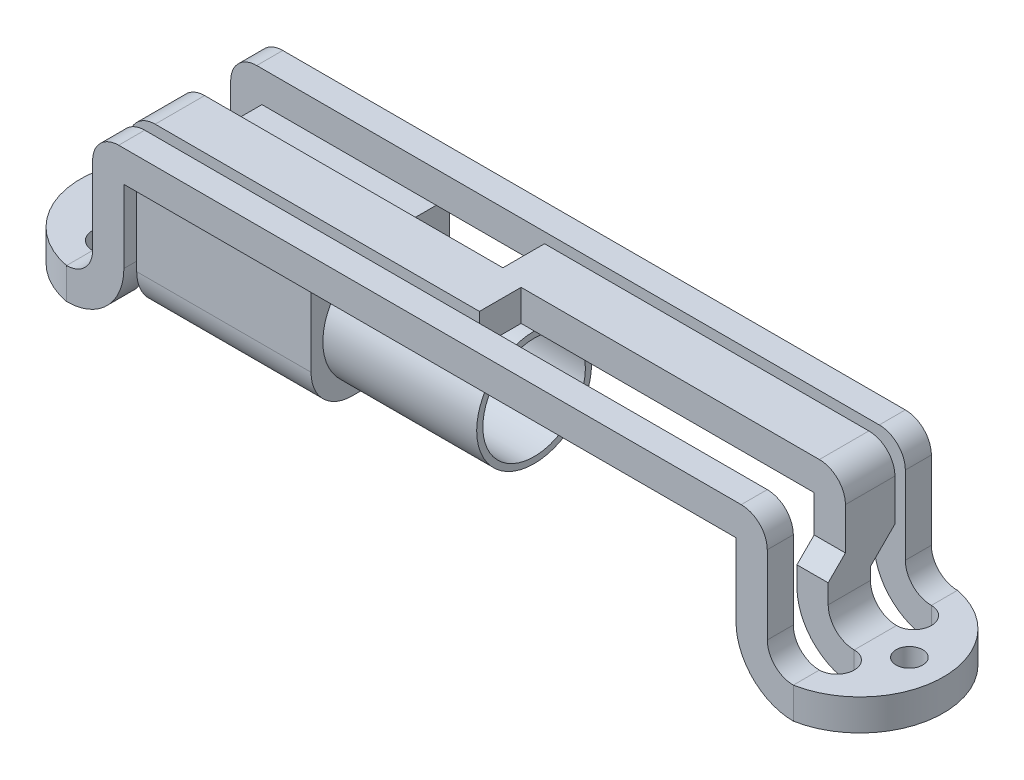
from build123d import *

# Parameters (mm, degrees)
EXTRUDE_THIN1_DEPTH    = 16.002
CUT_EXTRUDE1_START     = -15.748
CUT_EXTRUDE1_OUTLINE_R = 1.3
CUT_EXTRUDE1_DEPTH     = 15.748
BOSS_EXTRUDE2_DEPTH    = 1.68
BOSS_EXTRUDE3_START    = 1.68
BOSS_EXTRUDE3_DEPTH    = 1.68
CUT_EXTRUDE2_START     = -2.384
CUT_EXTRUDE2_DEPTH     = 2.384
CUT_EXTRUDE3_DEPTH     = 2.384
CHAMFER1_SIZE          = 1.7
CHAMFER2_SIZE          = 2.38
SKETCH10_W             = 17
SKETCH10_H             = 13.5
BOSS_EXTRUDE4_DEPTH    = 12
SKETCH11_R             = 5.6
SKETCH11_R_2           = 5
BOSS_EXTRUDE5_DEPTH    = 15
FILLET1_R              = 4


# Read off the part's stored shape, not the designer's step: Cut-Extrude1
with BuildPart() as part:
    # Sketch1 → Extrude-Thin1 (new body)
    with BuildSketch(Plane.XY):
        with BuildLine():
            Line((-42.06875, -12.7), (-35.433, -12.7))
            ThreePointArc((-35.433, -12.7), (-33.636948776, -11.956051224), (-32.893, -10.16))
            Line((-32.893, -10.16), (-32.893, -2.54))
            ThreePointArc((-32.893, -2.54), (-32.149051224, -0.743948776), (-30.353, 0))
            Line((-30.353, 0), (30.353, 0))
            ThreePointArc((30.353, 0), (32.149051224, -0.743948776), (32.893, -2.54))
            Line((32.893, -2.54), (32.893, -10.16))
            ThreePointArc((32.893, -10.16), (33.636948776, -11.956051224), (35.433, -12.7))
            Line((35.433, -12.7), (42.06875, -12.7))
            Line((42.06875, -12.7), (42.06875, -15.748))
            Line((42.06875, -15.748), (35.433, -15.748))
            ThreePointArc((35.433, -15.748), (31.481687307, -14.111312693), (29.845, -10.16))
            Line((29.845, -10.16), (29.845, -3.048))
            Line((29.845, -3.048), (-29.845, -3.048))
            Line((-29.845, -3.048), (-29.845, -10.16))
            ThreePointArc((-29.845, -10.16), (-31.481687307, -14.111312693), (-35.433, -15.748))
            Line((-35.433, -15.748), (-42.06875, -15.748))
            Line((-42.06875, -15.748), (-42.06875, -12.7))
        make_face()
    extrude(amount=-EXTRUDE_THIN1_DEPTH)

    # Cut-Extrude1 outline → Cut-Extrude1 (cut)
    with BuildSketch(Plane(origin=(0, 0, 0), x_dir=(1, 0, 0), z_dir=(0, 1, 0)).offset(CUT_EXTRUDE1_START)):
        with BuildLine():
            Line((35.433, 13.462), (-35.433, 13.462))
            ThreePointArc((-35.433, 13.462), (-37.133, 11.762), (-35.433, 10.062))
            Line((-35.433, 10.062), (-32.893, 10.062))
            Line((-32.893, 10.062), (-32.893, 8.382))
            Line((-32.893, 8.382), (-1.27, 8.382))
            Line((-1.27, 8.382), (-1.27, 12.446))
            Line((-1.27, 12.446), (32.893, 12.446))
            Line((32.893, 12.446), (32.893, 10.062))
            Line((32.893, 10.062), (35.433, 10.062))
            ThreePointArc((35.433, 10.062), (37.133, 11.762), (35.433, 13.462))
        make_face()
        with BuildLine():
            Line((32.893, 5.94), (32.893, 7.62))
            Line((32.893, 7.62), (1.27, 7.62))
            Line((1.27, 7.62), (1.27, 3.556))
            Line((1.27, 3.556), (-32.893, 3.556))
            Line((-32.893, 3.556), (-32.893, 5.94))
            Line((-32.893, 5.94), (-35.433, 5.94))
            ThreePointArc((-35.433, 5.94), (-37.133, 4.24), (-35.433, 2.54))
            Line((-35.433, 2.54), (35.433, 2.54))
            ThreePointArc((35.433, 2.54), (37.133, 4.24), (35.433, 5.94))
            Line((35.433, 5.94), (32.893, 5.94))
        make_face()
        with BuildLine():
            Line((42.06875, 16.002), (35.433, 16.002))
            ThreePointArc((35.433, 16.002), (40.193949205, 13.198335352), (42.06875, 8.001))
            Line((42.06875, 8.001), (42.06875, 16.002))
        make_face()
        with BuildLine():
            Line((42.06875, 0), (42.06875, 8.001))
            ThreePointArc((42.06875, 8.001), (40.193949205, 2.803664648), (35.433, 0))
            Line((35.433, 0), (42.06875, 0))
        make_face()
        with BuildLine():
            ThreePointArc((-42.06875, 8.001), (-40.193949205, 13.198335352), (-35.433, 16.002))
            Line((-35.433, 16.002), (-42.06875, 16.002))
            Line((-42.06875, 16.002), (-42.06875, 8.001))
        make_face()
        with BuildLine():
            ThreePointArc((-35.433, 0), (-40.193949205, 2.803664648), (-42.06875, 8.001))
            Line((-42.06875, 8.001), (-42.06875, 0))
            Line((-42.06875, 0), (-35.433, 0))
        make_face()
        with Locations((38.750875, 8.001)):
            Circle(CUT_EXTRUDE1_OUTLINE_R)
        with Locations((-38.750875, 8.001)):
            Circle(CUT_EXTRUDE1_OUTLINE_R)
    extrude(amount=CUT_EXTRUDE1_DEPTH, mode=Mode.SUBTRACT)

    # Sketch6 → Boss-Extrude2 (add)
    with BuildSketch(Plane(origin=(0, 0, -8.382), x_dir=(-1, 0, 0), z_dir=(0, 0, -1))):
        with BuildLine():
            Line((32.893, -10.16), (32.893, -6.604))
            Line((32.893, -6.604), (29.845, -6.604))
            Line((29.845, -6.604), (29.845, -10.16))
            ThreePointArc((29.845, -10.16), (30.667537588, -13.078237824), (32.893, -15.137363157))
            Line((32.893, -15.137363157), (32.893, -10.16))
        make_face()
    extrude(amount=BOSS_EXTRUDE2_DEPTH)

    # Sketch7 → Boss-Extrude3 (add)
    with BuildSketch(Plane.XY.offset(-7.62).offset(BOSS_EXTRUDE3_START)):
        with BuildLine():
            Line((32.893, -10.16), (32.893, -6.6))
            Line((32.893, -6.6), (29.845, -6.604))
            Line((29.845, -6.604), (29.845, -10.16))
            ThreePointArc((29.845, -10.16), (30.667537588, -13.078237824), (32.893, -15.137363157))
            Line((32.893, -15.137363157), (32.893, -10.16))
        make_face()
    extrude(amount=-BOSS_EXTRUDE3_DEPTH)

    # Sketch8 → Cut-Extrude2 (cut)
    with BuildSketch(Plane(origin=(0, 0, -12.446), x_dir=(-1, 0, 0), z_dir=(0, 0, -1)).offset(CUT_EXTRUDE2_START)):
        with BuildLine():
            Line((-32.893, -15.137363157), (-32.893, -6.6))
            Line((-32.893, -6.6), (-29.845, -6.604))
            Line((-29.845, -6.604), (-29.845, -10.16))
            ThreePointArc((-29.845, -10.16), (-30.667537588, -13.078237824), (-32.893, -15.137363157))
        make_face()
    extrude(amount=CUT_EXTRUDE2_DEPTH, mode=Mode.SUBTRACT)

    # Sketch9 → Cut-Extrude3 (cut)
    with BuildSketch(Plane.XY.offset(-3.556)):
        with BuildLine():
            Line((-32.893, -15.137363157), (-32.893, -6.604))
            Line((-32.893, -6.604), (-29.845, -6.604))
            Line((-29.845, -6.604), (-29.845, -10.16))
            ThreePointArc((-29.845, -10.16), (-30.667537588, -13.078237824), (-32.893, -15.137363157))
        make_face()
    extrude(amount=-CUT_EXTRUDE3_DEPTH, mode=Mode.SUBTRACT)

    # Chamfer1
    # the kernel refuses this chamfer: 1.7 mm, written as the material it adds along each edge
    # the kernel refuses this chamfer: 1.7 mm, written as the material it takes off along each edge
    with BuildSketch(Plane(origin=(-37.26486108, -6.604, -10.062), x_dir=(0, -0.9996219169112968, -0.02749587661058687), z_dir=(1, 0, 0))) as chamfer1_2_piece_1_section:
        Polygon((CHAMFER1_SIZE * 0.999621916911, -CHAMFER1_SIZE * 0.0274958766106), (-CHAMFER1_SIZE * 0.0274958766106, -CHAMFER1_SIZE * 0.999621916911), (0, 0), align=None)
    chamfer1_2_piece_1 = extrude(amount=11.791722159, mode=Mode.PRIVATE)
    chamfer1_2_piece_1 = split(chamfer1_2_piece_1, bisect_by=Plane(origin=(-31.369, -7.170744186, -8.382), z_dir=(0, 0, -1)), keep=Keep.TOP, mode=Mode.PRIVATE)
    add(chamfer1_2_piece_1, mode=Mode.SUBTRACT)
    with BuildSketch(Plane(origin=(37.264857315, -6.594262654, -5.94), x_dir=(0.00131183865632537, -0.9996210561251475, 0.02749587661058631), z_dir=(-0.999999138888279, -0.0013123348279305267, 0))) as chamfer1_2_piece_2_section:
        Polygon((CHAMFER1_SIZE * 0.999621916911, -CHAMFER1_SIZE * 0.0274958766106), (-CHAMFER1_SIZE * 0.0274958766106, -CHAMFER1_SIZE * 0.999621916911), (0, 0), align=None)
    chamfer1_2_piece_2 = extrude(amount=11.791724784, mode=Mode.PRIVATE)
    chamfer1_2_piece_2 = split(chamfer1_2_piece_2, bisect_by=Plane(origin=(31.369, -7.168744674, -7.62), z_dir=(0, 0, 1)), keep=Keep.TOP, mode=Mode.PRIVATE)
    add(chamfer1_2_piece_2, mode=Mode.SUBTRACT)

    # Chamfer2
    chamfer2_edges = [part.edges().sort_by_distance(p)[0] for p in [
        (31.369, -6.602, -10.062),
        (-31.369, -6.604, -5.94),
    ]]
    chamfer(chamfer2_edges, length=CHAMFER2_SIZE)

    # Sketch10 → Boss-Extrude4 (add)
    with BuildSketch(Plane.XZ.offset(3.048)):
        with Locations((-21.345, -8.001)):
            Rectangle(SKETCH10_W, SKETCH10_H)
    extrude(amount=BOSS_EXTRUDE4_DEPTH)

    # Sketch11 → Boss-Extrude5 (add)
    with BuildSketch(Plane(origin=(-12.845, 0, 0), x_dir=(0, 0, -1), z_dir=(1, 0, 0))):
        with Locations(Location((8.001, -9.048, 0), (0, 0, 270))):
            Circle(SKETCH11_R)
        with Locations(Location((8.001, -9.048, 0), (0, 0, 90))):
            Circle(SKETCH11_R_2, mode=Mode.SUBTRACT)
    extrude(amount=BOSS_EXTRUDE5_DEPTH)

    # Fillet1
    fillet1_edges = [part.edges().sort_by_distance(p)[0] for p in [
        (-21.345, -15.048, -14.751),
        (-21.345, -15.048, -1.251),
    ]]
    fillet(fillet1_edges, radius=FILLET1_R)


solid = part.part
